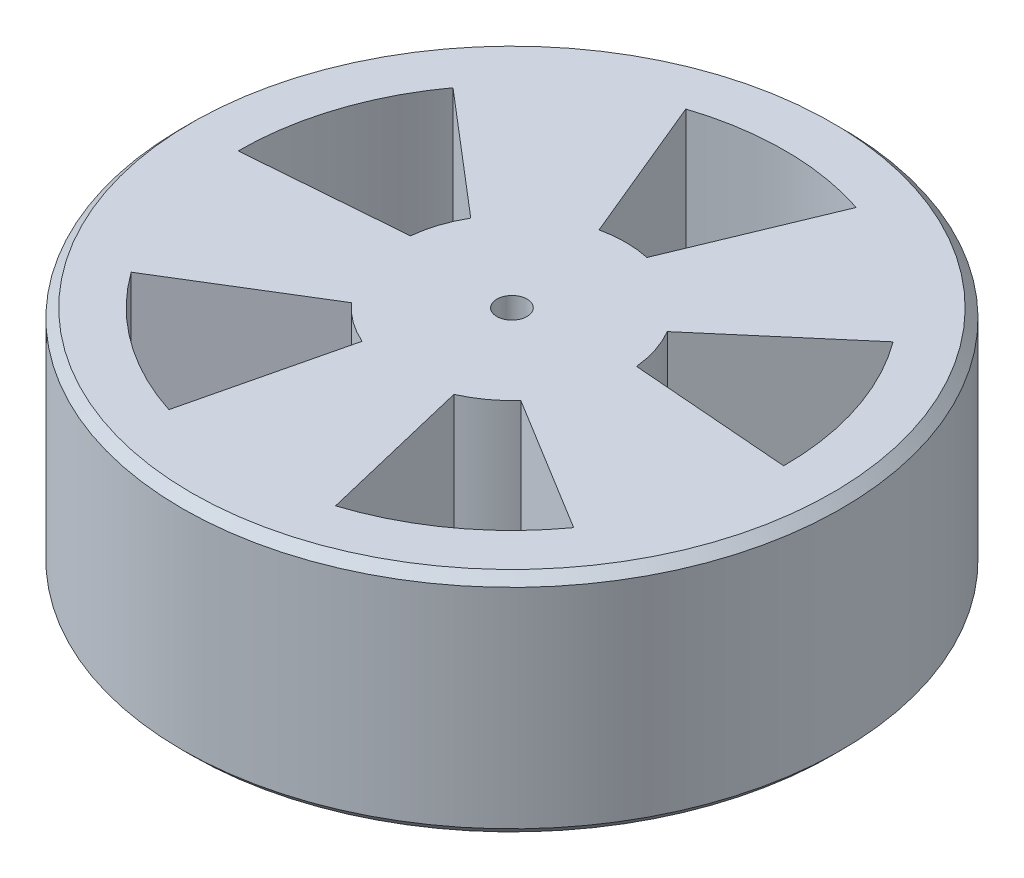
from build123d import *

# Parameters (mm, degrees)
SKETCH2_R               = 73.66
BOSS_EXTRUDE1_DEPTH     = 50.8
CHAMFER1_SIZE           = 2.032
CUT_EXTRUDE2_DEPTH      = 116.897502993
CUT_EXTRUDE2_DEPTH_BACK = 116.897502993
F_1_4_CLEARANCE_HOLE1_D = 6.7564


with BuildPart() as part:
    # Sketch2 → Boss-Extrude1 (new body)
    with BuildSketch(Plane(origin=(0, 0, 0), x_dir=(1, 0, 0), z_dir=(0, 1, 0))):
        Circle(SKETCH2_R)
    extrude(amount=BOSS_EXTRUDE1_DEPTH)

    # Chamfer1
    chamfer1_edges = [part.edges().sort_by_distance(p)[0] for p in [
        (-73.66, 0, 0),
        (-73.66, 50.8, 0),
    ]]
    chamfer(chamfer1_edges, length=CHAMFER1_SIZE)

    # Sketch4 → Cut-Extrude2 (cut, two sides: drawn at the far end of the back side and taken through both)
    with BuildSketch(Plane(origin=(0, 50.8, 0), x_dir=(1, 0, 0), z_dir=(0, 1, 0)).offset(-CUT_EXTRUDE2_DEPTH_BACK)):
        with BuildLine():
            Line((-5.349206117, 24.830344217), (-19.05, 57.906986625))
            ThreePointArc((-19.05, 57.906986625), (0, 60.96), (19.05, 57.906986625))
            Line((19.05, 57.906986625), (5.349206117, 24.830344217))
            ThreePointArc((5.349206117, 24.830344217), (0, 25.4), (-5.349206117, 24.830344217))
        make_face()
        with BuildLine():
            Line((21.962065073, 12.760395673), (49.186043226, 36.011869596))
            ThreePointArc((49.186043226, 36.011869596), (57.976405233, 18.837675977), (60.959590712, -0.223383675))
            Line((60.959590712, -0.223383675), (25.268056266, 2.585601005))
            ThreePointArc((25.268056266, 2.585601005), (24.156835514, 7.849031657), (21.962065073, 12.760395673))
        make_face()
        with BuildLine():
            Line((18.922508795, -16.943985981), (49.448646486, -35.650427217))
            ThreePointArc((49.448646486, -35.650427217), (35.83138898, -49.317675977), (18.625099, -58.045045329))
            Line((18.625099, -58.045045329), (10.267311485, -23.232354914))
            ThreePointArc((10.267311485, -23.232354914), (14.929745408, -20.549031657), (18.922508795, -16.943985981))
        make_face()
        with BuildLine():
            Line((-10.267311485, -23.232354914), (-18.625099, -58.045045329))
            ThreePointArc((-18.625099, -58.045045329), (-35.83138898, -49.317675977), (-49.448646486, -35.650427217))
            Line((-49.448646486, -35.650427217), (-18.922508795, -16.943985981))
            ThreePointArc((-18.922508795, -16.943985981), (-14.929745408, -20.549031657), (-10.267311485, -23.232354914))
        make_face()
        with BuildLine():
            Line((-25.268056266, 2.585601005), (-60.959590712, -0.223383675))
            ThreePointArc((-60.959590712, -0.223383675), (-57.976405233, 18.837675977), (-49.186043226, 36.011869596))
            Line((-49.186043226, 36.011869596), (-21.962065073, 12.760395673))
            ThreePointArc((-21.962065073, 12.760395673), (-24.156835514, 7.849031657), (-25.268056266, 2.585601005))
        make_face()
    extrude(amount=CUT_EXTRUDE2_DEPTH + CUT_EXTRUDE2_DEPTH_BACK, mode=Mode.SUBTRACT)

    # 1/4 Clearance Hole1 (through all)
    with Locations(Plane(origin=(0, 50.8, 0), x_dir=(1, 0, 0), z_dir=(0, 1, 0))):
        with Locations((0, 0)):
            Hole(F_1_4_CLEARANCE_HOLE1_D / 2)


solid = part.part
